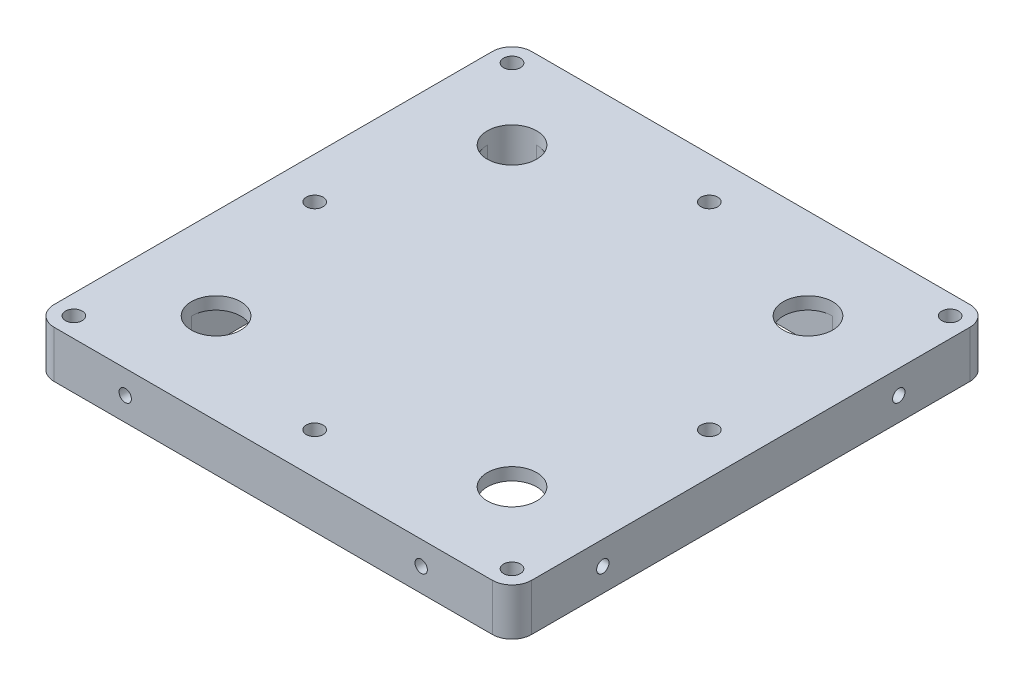
from build123d import *

# Parameters (mm, degrees)
SKETCH1_W                     = 96.825
SKETCH1_H                     = 96.825
BOSS_EXTRUDE1_DEPTH           = 4.7625
FILLET1_R                     = 4
M3X0_5_TAPPED_HOLE1_D         = 2.5
M3X0_5_TAPPED_HOLE1_DEPTH     = 10
M3X0_5_TAPPED_HOLE1_TIP       = 0.751075774
M3X0_5_TAPPED_HOLE2_D         = 2.5
M3X0_5_TAPPED_HOLE2_DEPTH     = 10
M3X0_5_TAPPED_HOLE2_TIP       = 0.751075774
M3_CLEARANCE_HOLE1_D          = 3.4
M3X0_5_TAPPED_HOLE3_D         = 2.5
M3X0_5_TAPPED_HOLE3_DEPTH     = 10
M3X0_5_TAPPED_HOLE3_TIP       = 0.751075774
M3X0_5_TAPPED_HOLE4_D         = 2.5
M3X0_5_TAPPED_HOLE4_DEPTH     = 10
M3X0_5_TAPPED_HOLE4_TIP       = 0.751075774
CSK_FOR_M3_SFHCS1_D           = 3.4
CSK_FOR_M3_SFHCS1_CSINK_D     = 6.72
CSK_FOR_M3_SFHCS1_CSINK_ANGLE = 90
CUT_EXTRUDE1_DEPTH            = 7
SKETCH21_R                    = 5
CUT_EXTRUDE2_DEPTH            = 69.822527653


with BuildPart() as part:
    # Sketch1 → Boss-Extrude1 (new, symmetric)
    with BuildSketch(Plane(origin=(0, 0, 0), x_dir=(1, 0, 0), z_dir=(0, 1, 0))):
        Rectangle(SKETCH1_W, SKETCH1_H)
    extrude(amount=BOSS_EXTRUDE1_DEPTH, both=True)

    # Fillet1
    fillet1_edges = [part.edges().sort_by_distance(p)[0] for p in [
        (-48.4125, 0, -48.4125),
        (48.4125, 0, -48.4125),
        (48.4125, 0, 48.4125),
        (-48.4125, 0, 48.4125),
    ]]
    fillet(fillet1_edges, radius=FILLET1_R)

    # M3x0.5 Tapped Hole1
    with Locations(Plane.ZY.offset(48.4125)):
        with Locations((-30, 0), (30, 0)):
            Hole(M3X0_5_TAPPED_HOLE1_D / 2, depth=M3X0_5_TAPPED_HOLE1_DEPTH)
            with Locations((0, 0, -(M3X0_5_TAPPED_HOLE1_DEPTH + M3X0_5_TAPPED_HOLE1_TIP / 2))):  # 118° drill point
                Cone(0, M3X0_5_TAPPED_HOLE1_D / 2, M3X0_5_TAPPED_HOLE1_TIP, mode=Mode.SUBTRACT)

    # M3x0.5 Tapped Hole2
    with Locations(Plane(origin=(0, 0, -48.4125), x_dir=(-1, 0, 0), z_dir=(0, 0, -1))):
        with Locations((-30, 0), (30, 0)):
            Hole(M3X0_5_TAPPED_HOLE2_D / 2, depth=M3X0_5_TAPPED_HOLE2_DEPTH)
            with Locations((0, 0, -(M3X0_5_TAPPED_HOLE2_DEPTH + M3X0_5_TAPPED_HOLE2_TIP / 2))):  # 118° drill point
                Cone(0, M3X0_5_TAPPED_HOLE2_D / 2, M3X0_5_TAPPED_HOLE2_TIP, mode=Mode.SUBTRACT)

    # M3 Clearance Hole1 (through all)
    with Locations(Plane(origin=(0, 4.7625, 0), x_dir=(1, 0, 0), z_dir=(0, 1, 0))):
        with Locations((-44.4125, 44.4125), (44.4125, 44.4125), (44.4125, -44.4125), (-44.4125, -44.4125)):
            Hole(M3_CLEARANCE_HOLE1_D / 2)

    # M3x0.5 Tapped Hole3
    with Locations(Plane(origin=(48.4125, 0, 0), x_dir=(0, 0, -1), z_dir=(1, 0, 0))):
        with Locations((-30, 0), (30, 0)):
            Hole(M3X0_5_TAPPED_HOLE3_D / 2, depth=M3X0_5_TAPPED_HOLE3_DEPTH)
            with Locations((0, 0, -(M3X0_5_TAPPED_HOLE3_DEPTH + M3X0_5_TAPPED_HOLE3_TIP / 2))):  # 118° drill point
                Cone(0, M3X0_5_TAPPED_HOLE3_D / 2, M3X0_5_TAPPED_HOLE3_TIP, mode=Mode.SUBTRACT)

    # M3x0.5 Tapped Hole4
    with Locations(Plane.XY.offset(48.4125)):
        with Locations((-30, 0), (30, 0)):
            Hole(M3X0_5_TAPPED_HOLE4_D / 2, depth=M3X0_5_TAPPED_HOLE4_DEPTH)
            with Locations((0, 0, -(M3X0_5_TAPPED_HOLE4_DEPTH + M3X0_5_TAPPED_HOLE4_TIP / 2))):  # 118° drill point
                Cone(0, M3X0_5_TAPPED_HOLE4_D / 2, M3X0_5_TAPPED_HOLE4_TIP, mode=Mode.SUBTRACT)

    # CSK for M3 SFHCS1 (through all)
    with Locations(Plane(origin=(0, -4.7625, 0), x_dir=(-1, 0, 0), z_dir=(0, -1, 0))):
        with Locations((-40, 0), (0, 40), (40, 0), (0, -40)):
            CounterSinkHole(CSK_FOR_M3_SFHCS1_D / 2, CSK_FOR_M3_SFHCS1_CSINK_D / 2, counter_sink_angle=CSK_FOR_M3_SFHCS1_CSINK_ANGLE)

    # Sketch20 → Cut-Extrude1 (cut)
    with BuildSketch(Plane.XZ.offset(4.7625)):
        with BuildLine():
            Line((30, -35), (-30, -35))
            ThreePointArc((-30, -35), (-33.535533906, -33.535533906), (-35, -30))
            Line((-35, -30), (-35, 30))
            ThreePointArc((-35, 30), (-33.535533906, 33.535533906), (-30, 35))
            Line((-30, 35), (30, 35))
            ThreePointArc((30, 35), (33.535533906, 33.535533906), (35, 30))
            Line((35, 30), (35, -30))
            ThreePointArc((35, -30), (33.535533906, -33.535533906), (30, -35))
        make_face()
    extrude(amount=-CUT_EXTRUDE1_DEPTH, mode=Mode.SUBTRACT)

    # Sketch21 → Cut-Extrude2 (cut, through all)
    with BuildSketch(Plane.XZ.offset(-2.2375)):
        with Locations((-30, 30)):
            Circle(SKETCH21_R)
        with Locations((30, 30)):
            Circle(SKETCH21_R)
        with Locations((30, -30)):
            Circle(SKETCH21_R)
        with Locations((-30, -30)):
            Circle(SKETCH21_R)
    extrude(amount=-CUT_EXTRUDE2_DEPTH, mode=Mode.SUBTRACT)


solid = part.part
